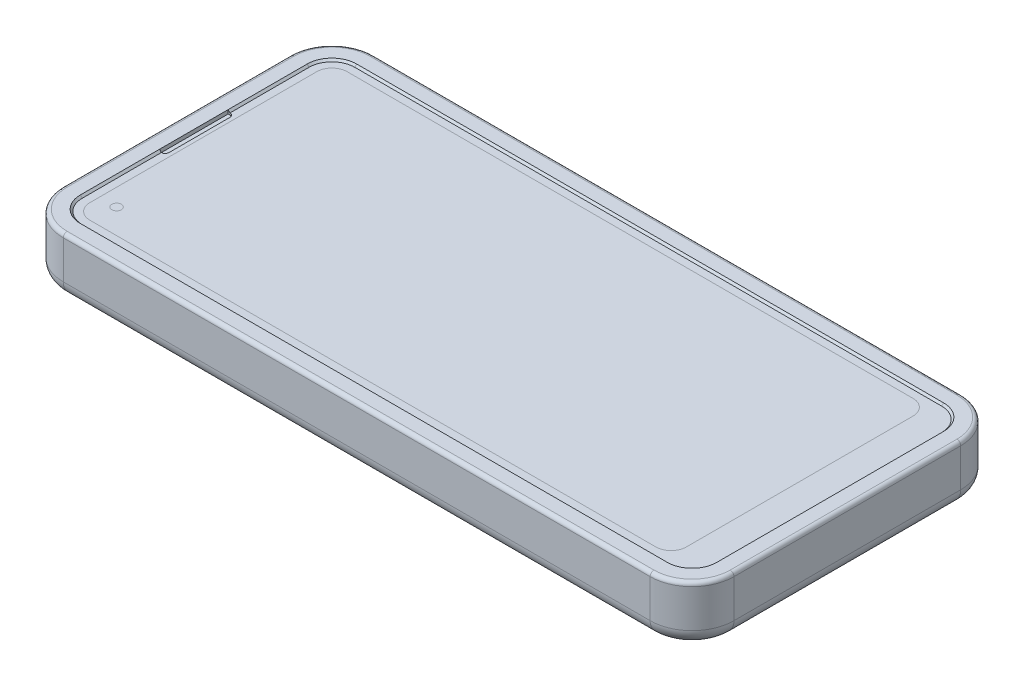
from build123d import *
from OCP.BRepFilletAPI import BRepFilletAPI_MakeChamfer

# Parameters (mm, degrees)
SALIENTE_EXTRUIR2_DEPTH    = 15
REDONDEO1_R                = 1
REDONDEO2_R                = 4
CORTAR_EXTRUIR1_DEPTH      = 0.5
CHAFL_N1_SIZE              = 0.5
CORTAR_EXTRUIR2_DEPTH      = 99.055150429
CORTAR_EXTRUIR2_DEPTH_BACK = 0.5
CROQUIS6_R                 = 8
CORTAR_EXTRUIR3_DEPTH      = 3.5
CHAFL_N2_SIZE              = 2
CHAFL_N2_SIZE2             = 3.464101615
CROQUIS7_R                 = 3.5
CROQUIS7_R_2               = 3
SALIENTE_EXTRUIR3_DEPTH    = 0.5
REDONDEO5_R                = 0.25


with BuildPart() as part:
    # Croquis1 → Saliente-Extruir2 (new body)
    with BuildSketch(Plane(origin=(0, 0, 0), x_dir=(1, 0, 0), z_dir=(0, 1, 0))):
        with BuildLine():
            Line((-77, 40.75), (77, 40.75))
            ThreePointArc((77, 40.75), (84.778174593, 37.528174593), (88, 29.75))
            Line((88, 29.75), (88, -29.75))
            ThreePointArc((88, -29.75), (84.778174593, -37.528174593), (77, -40.75))
            Line((77, -40.75), (-77, -40.75))
            ThreePointArc((-77, -40.75), (-84.778174593, -37.528174593), (-88, -29.75))
            Line((-88, -29.75), (-88, 29.75))
            ThreePointArc((-88, 29.75), (-84.778174593, 37.528174593), (-77, 40.75))
        make_face()
    extrude(amount=SALIENTE_EXTRUIR2_DEPTH)

    # Redondeo1
    redondeo1_edges = [part.edges().sort_by_distance(p)[0] for p in [
        (84.778174593, 15, 37.528174593),
        (88, 15, 0),
        (84.778174593, 15, -37.528174593),
        (0, 15, -40.75),
        (-84.778174593, 15, -37.528174593),
        (-88, 15, 0),
        (-84.778174593, 15, 37.528174593),
        (0, 15, 40.75),
    ]]
    fillet(redondeo1_edges, radius=REDONDEO1_R)

    # Redondeo2
    redondeo2_edges = [part.edges().sort_by_distance(p)[0] for p in [
        (88, 0, 0),
        (84.778174593, 0, 37.528174593),
        (0, 0, 40.75),
        (-84.778174593, 0, 37.528174593),
        (-88, 0, 0),
        (-84.778174593, 0, -37.528174593),
        (0, 0, -40.75),
        (84.778174593, 0, -37.528174593),
    ]]
    fillet(redondeo2_edges, radius=REDONDEO2_R)

    # Croquis2 → Cortar-Extruir1 (cut)
    with BuildSketch(Plane(origin=(0, 15, 0), x_dir=(1, 0, 0), z_dir=(0, 1, 0))):
        with BuildLine():
            Line((77, 35.75), (-77, 35.75))
            ThreePointArc((-77, 35.75), (-81.242640687, 33.992640687), (-83, 29.75))
            Line((-83, 29.75), (-83, -29.75))
            ThreePointArc((-83, -29.75), (-81.242640687, -33.992640687), (-77, -35.75))
            Line((-77, -35.75), (77, -35.75))
            ThreePointArc((77, -35.75), (81.242640687, -33.992640687), (83, -29.75))
            Line((83, -29.75), (83, 29.75))
            ThreePointArc((83, 29.75), (81.242640687, 33.992640687), (77, 35.75))
        make_face()
    extrude(amount=-CORTAR_EXTRUIR1_DEPTH, mode=Mode.SUBTRACT)

    # Chaflán1
    chafl_n1_edges = [part.edges().sort_by_distance(p)[0] for p in [
        (83, 15, 0),
        (81.242640687, 15, -33.992640687),
        (81.242640687, 15, 33.992640687),
        (0, 15, -35.75),
        (0, 15, 35.75),
        (-81.242640687, 15, -33.992640687),
        (-81.242640687, 15, 33.992640687),
        (-83, 15, 0),
    ]]
    chamfer(chafl_n1_edges, length=CHAFL_N1_SIZE - 0.0001)  # a hair under: the kernel refuses the full size

    # Croquis5 → Cortar-Extruir2 (cut, two sides: drawn at the far end of the back side and taken through both)
    with BuildSketch(Plane(origin=(0, 14.5, 0), x_dir=(1, 0, 0), z_dir=(0, 1, 0)).offset(-CORTAR_EXTRUIR2_DEPTH_BACK)):
        with BuildLine():
            Line((-83.5, 9), (-83, 9))
            ThreePointArc((-83, 9), (-82.292893219, 8.707106781), (-82, 8))
            Line((-82, 8), (-82, -8))
            ThreePointArc((-82, -8), (-82.292893219, -8.707106781), (-83, -9))
            Line((-83, -9), (-83.5, -9))
            Line((-83.5, -9), (-83.5, 9))
        make_face()
    extrude(amount=CORTAR_EXTRUIR2_DEPTH + CORTAR_EXTRUIR2_DEPTH_BACK, mode=Mode.SUBTRACT)

    # Croquis6 → Cortar-Extruir3 (cut)
    with BuildSketch(Plane.XZ):
        with Locations(Location((-42, 0, 0), (0, 0, 270))):
            Circle(CROQUIS6_R)
        with BuildLine():
            Line((-73.5, -4.75), (-57.5, -4.75))
            ThreePointArc((-57.5, -4.75), (-53.257359313, -6.507359313), (-51.5, -10.75))
            Line((-51.5, -10.75), (-51.5, -26.75))
            ThreePointArc((-51.5, -26.75), (-53.257359313, -30.992640687), (-57.5, -32.75))
            Line((-57.5, -32.75), (-73.5, -32.75))
            ThreePointArc((-73.5, -32.75), (-77.742640687, -30.992640687), (-79.5, -26.75))
            Line((-79.5, -26.75), (-79.5, -10.75))
            ThreePointArc((-79.5, -10.75), (-77.742640687, -6.507359313), (-73.5, -4.75))
        make_face()
    extrude(amount=-CORTAR_EXTRUIR3_DEPTH, mode=Mode.SUBTRACT)

    # Chaflán2: one chamfer whose edges measure the first distance from different faces: ONE call of the kernel's chamfer builder (chamfer() names one face for all edges)
    chafl_n2_edges_1 = [part.edges().sort_by_distance(p)[0] for p in [
        (-42, 0, 8),
    ]]
    chafl_n2_side_1 = [part.faces().sort_by_distance(p)[0] for p in [
        (5.089288443, 0, 1.243908582),
    ]]
    chafl_n2_edges_2 = [part.edges().sort_by_distance(p)[0] for p in [
        (-77.742640687, 3.5, -30.992640687),
    ]]
    chafl_n2_side_2 = [part.faces().sort_by_distance(p)[0] for p in [
        (-77.742640687, 1.75, -30.992640687),
    ]]
    chafl_n2_edges_3 = [part.edges().sort_by_distance(p)[0] for p in [
        (-79.5, 3.5, -18.75),
    ]]
    chafl_n2_side_3 = [part.faces().sort_by_distance(p)[0] for p in [
        (-79.5, 1.75, -18.75),
    ]]
    chafl_n2_edges_4 = [part.edges().sort_by_distance(p)[0] for p in [
        (-77.742640687, 3.5, -6.507359313),
    ]]
    chafl_n2_side_4 = [part.faces().sort_by_distance(p)[0] for p in [
        (-77.742640687, 1.75, -6.507359313),
    ]]
    chafl_n2_edges_5 = [part.edges().sort_by_distance(p)[0] for p in [
        (-65.5, 3.5, -4.75),
    ]]
    chafl_n2_side_5 = [part.faces().sort_by_distance(p)[0] for p in [
        (-65.5, 1.75, -4.75),
    ]]
    chafl_n2_edges_6 = [part.edges().sort_by_distance(p)[0] for p in [
        (-53.257359313, 3.5, -6.507359313),
    ]]
    chafl_n2_side_6 = [part.faces().sort_by_distance(p)[0] for p in [
        (-53.257359313, 1.75, -6.507359313),
    ]]
    chafl_n2_edges_7 = [part.edges().sort_by_distance(p)[0] for p in [
        (-51.5, 3.5, -18.75),
    ]]
    chafl_n2_side_7 = [part.faces().sort_by_distance(p)[0] for p in [
        (-51.5, 1.75, -18.75),
    ]]
    chafl_n2_edges_8 = [part.edges().sort_by_distance(p)[0] for p in [
        (-53.257359313, 3.5, -30.992640687),
    ]]
    chafl_n2_side_8 = [part.faces().sort_by_distance(p)[0] for p in [
        (-53.257359313, 1.75, -30.992640687),
    ]]
    chafl_n2_edges_9 = [part.edges().sort_by_distance(p)[0] for p in [
        (-65.5, 3.5, -32.75),
    ]]
    chafl_n2_side_9 = [part.faces().sort_by_distance(p)[0] for p in [
        (-65.5, 1.75, -32.75),
    ]]
    chafl_n2 = BRepFilletAPI_MakeChamfer(part.part.solid().wrapped)
    for e in chafl_n2_edges_1:
        chafl_n2.Add(CHAFL_N2_SIZE, CHAFL_N2_SIZE2, e.wrapped, chafl_n2_side_1[0].wrapped)  # the first distance lies on this face
    for e in chafl_n2_edges_2:
        chafl_n2.Add(CHAFL_N2_SIZE, CHAFL_N2_SIZE2, e.wrapped, chafl_n2_side_2[0].wrapped)  # the first distance lies on this face
    for e in chafl_n2_edges_3:
        chafl_n2.Add(CHAFL_N2_SIZE, CHAFL_N2_SIZE2, e.wrapped, chafl_n2_side_3[0].wrapped)  # the first distance lies on this face
    for e in chafl_n2_edges_4:
        chafl_n2.Add(CHAFL_N2_SIZE, CHAFL_N2_SIZE2, e.wrapped, chafl_n2_side_4[0].wrapped)  # the first distance lies on this face
    for e in chafl_n2_edges_5:
        chafl_n2.Add(CHAFL_N2_SIZE, CHAFL_N2_SIZE2, e.wrapped, chafl_n2_side_5[0].wrapped)  # the first distance lies on this face
    for e in chafl_n2_edges_6:
        chafl_n2.Add(CHAFL_N2_SIZE, CHAFL_N2_SIZE2, e.wrapped, chafl_n2_side_6[0].wrapped)  # the first distance lies on this face
    for e in chafl_n2_edges_7:
        chafl_n2.Add(CHAFL_N2_SIZE, CHAFL_N2_SIZE2, e.wrapped, chafl_n2_side_7[0].wrapped)  # the first distance lies on this face
    for e in chafl_n2_edges_8:
        chafl_n2.Add(CHAFL_N2_SIZE, CHAFL_N2_SIZE2, e.wrapped, chafl_n2_side_8[0].wrapped)  # the first distance lies on this face
    for e in chafl_n2_edges_9:
        chafl_n2.Add(CHAFL_N2_SIZE, CHAFL_N2_SIZE2, e.wrapped, chafl_n2_side_9[0].wrapped)  # the first distance lies on this face
    add(Compound.cast(chafl_n2.Shape()), mode=Mode.REPLACE)

    # Croquis7 → Saliente-Extruir3 (add)
    # profile 1 of 4: a face of its own
    with BuildSketch(Plane.XZ.offset(-3.5)):
        with Locations(Location((-70.5, -23.75, 0), (0, 0, 270))):
            Circle(CROQUIS7_R)
        with Locations(Location((-70.5, -23.75, 0), (0, 0, 270))):
            Circle(CROQUIS7_R_2, mode=Mode.SUBTRACT)
    # profile 2 of 4: a face of its own
    with BuildSketch(Plane.XZ.offset(-3.5)):
        with Locations(Location((-60.5, -23.75, 0), (0, 0, 270))):
            Circle(CROQUIS7_R)
        with Locations(Location((-60.5, -23.75, 0), (0, 0, 270))):
            Circle(CROQUIS7_R_2, mode=Mode.SUBTRACT)
    # profile 3 of 4: a face of its own
    with BuildSketch(Plane.XZ.offset(-3.5)):
        with Locations(Location((-60.5, -13.75, 0), (0, 0, 270))):
            Circle(CROQUIS7_R)
        with Locations(Location((-60.5, -13.75, 0), (0, 0, 270))):
            Circle(CROQUIS7_R_2, mode=Mode.SUBTRACT)
    # profile 4 of 4: a face of its own
    with BuildSketch(Plane.XZ.offset(-3.5)):
        with Locations(Location((-70.5, -13.75, 0), (0, 0, 270))):
            Circle(CROQUIS7_R)
        with Locations(Location((-70.5, -13.75, 0), (0, 0, 270))):
            Circle(CROQUIS7_R_2, mode=Mode.SUBTRACT)
    extrude(amount=SALIENTE_EXTRUIR3_DEPTH)

    # Redondeo5
    redondeo5_edges = [part.edges().sort_by_distance(p)[0] for p in [
        (-70.5, 3, -20.25),
        (-70.5, 3, -20.75),
        (-60.5, 3.5, -20.25),
        (-60.5, 3, -20.75),
        (-60.5, 3.5, -10.75),
        (-60.5, 3, -10.25),
        (-60.5, 3, -10.75),
        (-70.5, 3, -10.25),
        (-70.5, 3, -10.75),
    ]]
    fillet(redondeo5_edges, radius=REDONDEO5_R - 0.0001)  # a hair under: the kernel refuses the full size


solid = part.part
